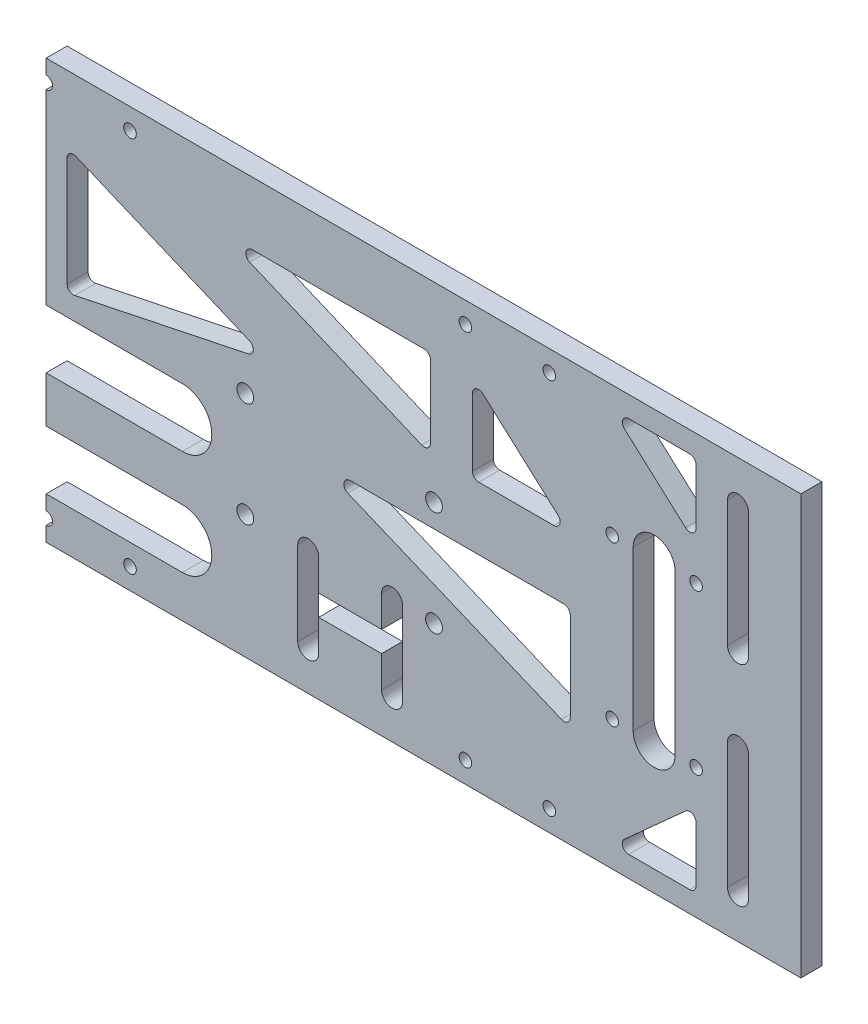
from build123d import *

# Parameters (mm, degrees)
SKETCH_1_W           = 320
SKETCH_1_H           = 121
EXTRUDE_1_DEPTH      = 5
SKETCH_2_W           = 5
SKETCH_2_H           = 30
CUT_EXTRUDE_1_DEPTH  = 343.14909031
SKETCH_3_R           = 1.5
CUT_EXTRUDE_2_DEPTH  = 343.14909031
SKETCH_4_R           = 1.5
CUT_EXTRUDE_3_DEPTH  = 343.14909031
SKETCH_6_R           = 2
CUT_EXTRUDE_5_DEPTH  = 343.14909031
SKETCH_5_W           = 250
SKETCH_5_H           = 30
CUT_EXTRUDE_4_DEPTH  = 343.14909031
SKETCH_7_W           = 260
SKETCH_7_H           = 30
EXTRUDE_2_DEPTH      = 5
SKETCH_8_W           = 320
SKETCH_8_H           = 21
CUT_EXTRUDE_6_DEPTH  = 5
SKETCH_9_W           = 15
SKETCH_9_H           = 100
EXTRUDE_3_DEPTH      = 5
CUT_EXTRUDE_7_DEPTH  = 5
CUT_EXTRUDE_8_DEPTH  = 5
SKETCH_15_R          = 1.5
CUT_EXTRUDE_9_DEPTH  = 357.217630108
CUT_EXTRUDE_10_DEPTH = 357.217630108
CUT_EXTRUDE_11_DEPTH = 357.217630108
SKETCH_18_W          = 5
SKETCH_18_H          = 100
EXTRUDE_4_DEPTH      = 5
SKETCH_19_W          = 180
SKETCH_19_H          = 100
CUT_EXTRUDE_12_DEPTH = 10
SKETCH_20_R          = 2
CUT_EXTRUDE_13_DEPTH = 10


with BuildPart() as part:
    # 草图1 → 凸台-拉伸1 (new body)
    with BuildSketch(Plane.XY):
        with Locations((160, 60.5)):
            Rectangle(SKETCH_1_W, SKETCH_1_H)
    extrude(amount=EXTRUDE_1_DEPTH)

    # 草图2 → 切除-拉伸1 (cut, through all)
    with BuildSketch(Plane.XY.offset(5)):
        with Locations((32.5, 15)):
            Rectangle(SKETCH_2_W, SKETCH_2_H)
        with Locations((287.5, 15)):
            Rectangle(SKETCH_2_W, SKETCH_2_H)
    extrude(amount=-CUT_EXTRUDE_1_DEPTH, mode=Mode.SUBTRACT)

    # 草图3 → 切除-拉伸2 (cut, through all)
    with BuildSketch(Plane.XY.offset(5)):
        with Locations((40, 116)):
            Circle(SKETCH_3_R)
        with Locations((60, 116)):
            Circle(SKETCH_3_R)
        with Locations((140, 116)):
            Circle(SKETCH_3_R)
        with Locations((160, 116)):
            Circle(SKETCH_3_R)
        with Locations((260, 116)):
            Circle(SKETCH_3_R)
        with Locations((280, 116)):
            Circle(SKETCH_3_R)
        with Locations((180, 116)):
            Circle(SKETCH_3_R)
    extrude(amount=-CUT_EXTRUDE_2_DEPTH, mode=Mode.SUBTRACT)

    # 草图4 → 切除-拉伸3 (cut, through all)
    with BuildSketch(Plane.XY.offset(5)):
        with Locations((5, 90)):
            Circle(SKETCH_4_R)
        with Locations((25, 90)):
            Circle(SKETCH_4_R)
        with Locations((5, 10)):
            Circle(SKETCH_4_R)
        with Locations((25, 10)):
            Circle(SKETCH_4_R)
        with Locations((295, 10)):
            Circle(SKETCH_4_R)
        with Locations((315, 10)):
            Circle(SKETCH_4_R)
        with Locations((295, 90)):
            Circle(SKETCH_4_R)
        with Locations((315, 90)):
            Circle(SKETCH_4_R)
    extrude(amount=-CUT_EXTRUDE_3_DEPTH, mode=Mode.SUBTRACT)

    # 草图6 → 切除-拉伸5 (cut, through all)
    with BuildSketch(Plane.XY.offset(5)):
        with Locations((112.5, 75.5)):
            Circle(SKETCH_6_R)
        with Locations((207.5, 75.5)):
            Circle(SKETCH_6_R)
        with Locations((207.5, 50.5)):
            Circle(SKETCH_6_R)
        with Locations((112.5, 50.5)):
            Circle(SKETCH_6_R)
        with BuildLine():
            Line((127.5, 70), (192.5, 70))
            ThreePointArc((192.5, 70), (199.5, 63), (192.5, 56))
            Line((192.5, 56), (127.5, 56))
            ThreePointArc((127.5, 56), (120.5, 63), (127.5, 70))
        make_face()
    extrude(amount=-CUT_EXTRUDE_5_DEPTH, mode=Mode.SUBTRACT)

    # 草图5 → 切除-拉伸4 (cut, through all)
    with BuildSketch(Plane.XY.offset(5)):
        with BuildLine():
            Line((5, 101.368043607), (5, 114.5))
            ThreePointArc((5, 114.5), (5.439339828, 115.560660172), (6.5, 116))
            Line((6.5, 116), (21.091062659, 116))
            ThreePointArc((21.091062659, 116), (22.491493276, 115.037395651), (22.094509756, 113.385058781))
            Line((22.094509756, 113.385058781), (7.503447097, 100.253102388))
            ThreePointArc((7.503447097, 100.253102388), (5.889742123, 99.997793512), (5, 101.368043607))
        make_face()
        with BuildLine():
            Line((38.908937341, 85), (56.833333333, 85))
            ThreePointArc((56.833333333, 85), (57.893993505, 85.439339828), (58.333333333, 86.5))
            Line((58.333333333, 86.5), (58.333333333, 102.631956393))
            ThreePointArc((58.333333333, 102.631956393), (57.443591211, 104.002206488), (55.829886236, 103.746897612))
            Line((55.829886236, 103.746897612), (37.905490244, 87.614941219))
            ThreePointArc((37.905490244, 87.614941219), (37.508506724, 85.962604349), (38.908937341, 85))
        make_face()
        with BuildLine():
            Line((35, 68.5), (35, 47.25))
            ThreePointArc((35, 47.25), (35.667949706, 46.001924558), (37.076923077, 45.865384615))
            Line((37.076923077, 45.865384615), (88.076923077, 67.115384615))
            ThreePointArc((88.076923077, 67.115384615), (88.970871014, 68.794174203), (87.5, 70))
            Line((87.5, 70), (36.5, 70))
            ThreePointArc((36.5, 70), (35.439339828, 69.560660172), (35, 68.5))
        make_face()
        with Locations((160, 15)):
            Rectangle(SKETCH_5_W, SKETCH_5_H)
        with BuildLine():
            Line((68.333333333, 87.256929624), (68.333333333, 104.5))
            ThreePointArc((68.333333333, 104.5), (68.772673162, 105.560660172), (69.833333333, 106))
            Line((69.833333333, 106), (110.888262801, 106))
            ThreePointArc((110.888262801, 106), (112.358715068, 104.796260242), (111.469111528, 103.117026842))
            Line((111.469111528, 103.117026842), (70.41418206, 85.873956465))
            ThreePointArc((70.41418206, 85.873956465), (69.00305419, 86.007675228), (68.333333333, 87.256929624))
        make_face()
        with BuildLine():
            Line((111.788920254, 84.01540935), (153.193641955, 75.376872258))
            ThreePointArc((153.193641955, 75.376872258), (154.446166722, 75.68130869), (155, 76.845253935))
            Line((155, 76.845253935), (155, 102.873774141))
            ThreePointArc((155, 102.873774141), (154.330279143, 104.123028536), (152.919151273, 104.256747299))
            Line((152.919151273, 104.256747299), (111.514429572, 86.866764185))
            ThreePointArc((111.514429572, 86.866764185), (110.602180826, 85.340055375), (111.788920254, 84.01540935))
        make_face()
        with BuildLine():
            Line((167.080848727, 104.256747299), (208.485570428, 86.866764185))
            ThreePointArc((208.485570428, 86.866764185), (209.397819174, 85.340055375), (208.211079746, 84.01540935))
            Line((208.211079746, 84.01540935), (166.806358045, 75.376872258))
            ThreePointArc((166.806358045, 75.376872258), (165.553833278, 75.68130869), (165, 76.845253935))
            Line((165, 76.845253935), (165, 102.873774141))
            ThreePointArc((165, 102.873774141), (165.669720857, 104.123028536), (167.080848727, 104.256747299))
        make_face()
        with BuildLine():
            Line((208.530888472, 103.117026842), (249.58581794, 85.873956465))
            ThreePointArc((249.58581794, 85.873956465), (250.99694581, 86.007675228), (251.666666667, 87.256929624))
            Line((251.666666667, 87.256929624), (251.666666667, 104.5))
            ThreePointArc((251.666666667, 104.5), (251.227326838, 105.560660172), (250.166666667, 106))
            Line((250.166666667, 106), (209.111737199, 106))
            ThreePointArc((209.111737199, 106), (207.641284932, 104.796260242), (208.530888472, 103.117026842))
        make_face()
        with BuildLine():
            Line((232.5, 70), (283.5, 70))
            ThreePointArc((283.5, 70), (284.560660172, 69.560660172), (285, 68.5))
            Line((285, 68.5), (285, 47.25))
            ThreePointArc((285, 47.25), (284.332050294, 46.001924558), (282.923076923, 45.865384615))
            Line((282.923076923, 45.865384615), (231.923076923, 67.115384615))
            ThreePointArc((231.923076923, 67.115384615), (231.029128986, 68.794174203), (232.5, 70))
        make_face()
        with BuildLine():
            Line((264.170113764, 103.746897612), (282.094509756, 87.614941219))
            ThreePointArc((282.094509756, 87.614941219), (282.491493276, 85.962604349), (281.091062659, 85))
            Line((281.091062659, 85), (263.166666667, 85))
            ThreePointArc((263.166666667, 85), (262.106006495, 85.439339828), (261.666666667, 86.5))
            Line((261.666666667, 86.5), (261.666666667, 102.631956393))
            ThreePointArc((261.666666667, 102.631956393), (262.556408789, 104.002206488), (264.170113764, 103.746897612))
        make_face()
        with BuildLine():
            Line((297.905490244, 113.385058781), (312.496552903, 100.253102388))
            ThreePointArc((312.496552903, 100.253102388), (314.110257877, 99.997793512), (315, 101.368043607))
            Line((315, 101.368043607), (315, 114.5))
            ThreePointArc((315, 114.5), (314.560660172, 115.560660172), (313.5, 116))
            Line((313.5, 116), (298.908937341, 116))
            ThreePointArc((298.908937341, 116), (297.508506724, 115.037395651), (297.905490244, 113.385058781))
        make_face()
    extrude(amount=-CUT_EXTRUDE_4_DEPTH, mode=Mode.SUBTRACT)

    # 草图7 → 凸台-拉伸2 (add)
    with BuildSketch(Plane(origin=(0, 0, 0), x_dir=(-1, 0, 0), z_dir=(0, 0, -1))):
        with Locations((-160, 15)):
            Rectangle(SKETCH_7_W, SKETCH_7_H)
    extrude(amount=-EXTRUDE_2_DEPTH)

    # 草图8 → 切除-拉伸6 (cut)
    with BuildSketch(Plane(origin=(0, 0, 0), x_dir=(-1, 0, 0), z_dir=(0, 0, -1))):
        with Locations((-160, 10.5)):
            Rectangle(SKETCH_8_W, SKETCH_8_H)
    extrude(amount=-CUT_EXTRUDE_6_DEPTH, mode=Mode.SUBTRACT)

    # 草图9 → 凸台-拉伸3 (add)
    with BuildSketch(Plane(origin=(0, 0, 0), x_dir=(-1, 0, 0), z_dir=(0, 0, -1))):
        with Locations((-327.5, 71)):
            Rectangle(SKETCH_9_W, SKETCH_9_H)
        with Locations((7.5, 71)):
            Rectangle(SKETCH_9_W, SKETCH_9_H)
    extrude(amount=-EXTRUDE_3_DEPTH)

    # 草图10 → 切除-拉伸7 (cut)
    with BuildSketch(Plane(origin=(0, 0, 0), x_dir=(-1, 0, 0), z_dir=(0, 0, -1))):
        with BuildLine():
            ThreePointArc((-327.5, 81), (-325, 78.5), (-322.5, 81))
            Line((-322.5, 81), (-322.5, 111))
            ThreePointArc((-322.5, 111), (-325, 113.5), (-327.5, 111))
            Line((-327.5, 111), (-327.5, 81))
        make_face()
        with BuildLine():
            ThreePointArc((-322.5, 61), (-325, 63.5), (-327.5, 61))
            Line((-327.5, 61), (-327.5, 31))
            ThreePointArc((-327.5, 31), (-325, 28.5), (-322.5, 31))
            Line((-322.5, 31), (-322.5, 61))
        make_face()
        with BuildLine():
            ThreePointArc((2.5, 81), (5, 78.5), (7.5, 81))
            Line((7.5, 81), (7.5, 111))
            ThreePointArc((7.5, 111), (5, 113.5), (2.5, 111))
            Line((2.5, 111), (2.5, 81))
        make_face()
        with BuildLine():
            ThreePointArc((7.5, 61), (5, 63.5), (2.5, 61))
            Line((2.5, 61), (2.5, 31))
            ThreePointArc((2.5, 31), (5, 28.5), (7.5, 31))
            Line((7.5, 31), (7.5, 61))
        make_face()
    extrude(amount=-CUT_EXTRUDE_7_DEPTH, mode=Mode.SUBTRACT)

    # 草图13 → 切除-拉伸8 (cut)
    with BuildSketch(Plane(origin=(0, 0, 0), x_dir=(-1, 0, 0), z_dir=(0, 0, -1))):
        with BuildLine():
            ThreePointArc((-192.5, 45), (-199.5, 38), (-192.5, 31))
            Line((-192.5, 31), (-127.5, 31))
            ThreePointArc((-127.5, 31), (-120.5, 38), (-127.5, 45))
            Line((-127.5, 45), (-192.5, 45))
        make_face()
    extrude(amount=-CUT_EXTRUDE_8_DEPTH, mode=Mode.SUBTRACT)

    # 草图15 → 切除-拉伸9 (cut, through all)
    with BuildSketch(Plane(origin=(0, 0, 0), x_dir=(-1, 0, 0), z_dir=(0, 0, -1))):
        with BuildLine():
            ThreePointArc((-22.094509756, 28.614941219), (-22.491493276, 26.962604349), (-21.091062659, 26))
            Line((-21.091062659, 26), (-6.5, 26))
            ThreePointArc((-6.5, 26), (-5.439339828, 26.439339828), (-5, 27.5))
            Line((-5, 27.5), (-5, 40.631956393))
            ThreePointArc((-5, 40.631956393), (-5.889742123, 42.002206488), (-7.503447097, 41.746897612))
            Line((-7.503447097, 41.746897612), (-22.094509756, 28.614941219))
        make_face()
        with BuildLine():
            Line((-315, 40.631956393), (-315, 27.5))
            ThreePointArc((-315, 27.5), (-314.560660172, 26.439339828), (-313.5, 26))
            Line((-313.5, 26), (-298.908937341, 26))
            ThreePointArc((-298.908937341, 26), (-297.508506724, 26.962604349), (-297.905490244, 28.614941219))
            Line((-297.905490244, 28.614941219), (-312.496552903, 41.746897612))
            ThreePointArc((-312.496552903, 41.746897612), (-314.110257877, 42.002206488), (-315, 40.631956393))
        make_face()
        with Locations((-25, 52)):
            Circle(SKETCH_15_R)
        with Locations((-5, 52)):
            Circle(SKETCH_15_R)
        with Locations((-40, 26)):
            Circle(SKETCH_15_R)
        with Locations((-60, 26)):
            Circle(SKETCH_15_R)
        with Locations((-140, 26)):
            Circle(SKETCH_15_R)
        with Locations((-160, 26)):
            Circle(SKETCH_15_R)
        with Locations((-180, 26)):
            Circle(SKETCH_15_R)
        with Locations((-260, 26)):
            Circle(SKETCH_15_R)
        with Locations((-280, 26)):
            Circle(SKETCH_15_R)
        with Locations((-295, 52)):
            Circle(SKETCH_15_R)
        with Locations((-315, 52)):
            Circle(SKETCH_15_R)
    extrude(amount=-CUT_EXTRUDE_9_DEPTH, mode=Mode.SUBTRACT)

    # 草图16 → 切除-拉伸10 (cut, through all)
    with BuildSketch(Plane(origin=(0, 0, 0), x_dir=(-1, 0, 0), z_dir=(0, 0, -1))):
        with BuildLine():
            Line((-310, 90), (-310, 52))
            ThreePointArc((-310, 52), (-305, 47), (-300, 52))
            Line((-300, 52), (-300, 90))
            ThreePointArc((-300, 90), (-305, 95), (-310, 90))
        make_face()
        with BuildLine():
            Line((-20, 90), (-20, 52))
            ThreePointArc((-20, 52), (-15, 47), (-10, 52))
            Line((-10, 52), (-10, 90))
            ThreePointArc((-10, 90), (-15, 95), (-20, 90))
        make_face()
    extrude(amount=-CUT_EXTRUDE_10_DEPTH, mode=Mode.SUBTRACT)

    # 草图17 → 切除-拉伸11 (cut, through all)
    with BuildSketch(Plane(origin=(0, 0, 0), x_dir=(-1, 0, 0), z_dir=(0, 0, -1))):
        with BuildLine():
            ThreePointArc((-220, 50.5), (-222.5, 53), (-225, 50.5))
            Line((-225, 50.5), (-225, 43))
            Line((-225, 43), (-240, 43))
            Line((-240, 43), (-240, 50.5))
            ThreePointArc((-240, 50.5), (-242.5, 53), (-245, 50.5))
            Line((-245, 50.5), (-245, 30.5))
            ThreePointArc((-245, 30.5), (-242.5, 28), (-240, 30.5))
            Line((-240, 30.5), (-240, 38))
            Line((-240, 38), (-225, 38))
            Line((-225, 38), (-225, 30.5))
            ThreePointArc((-225, 30.5), (-222.5, 28), (-220, 30.5))
            Line((-220, 30.5), (-220, 50.5))
        make_face()
        with BuildLine():
            ThreePointArc((-95, 50.5), (-97.5, 53), (-100, 50.5))
            Line((-100, 50.5), (-100, 30.5))
            ThreePointArc((-100, 30.5), (-97.5, 28), (-95, 30.5))
            Line((-95, 30.5), (-95, 38))
            Line((-95, 38), (-80, 38))
            Line((-80, 38), (-80, 30.5))
            ThreePointArc((-80, 30.5), (-77.5, 28), (-75, 30.5))
            Line((-75, 30.5), (-75, 50.5))
            ThreePointArc((-75, 50.5), (-77.5, 53), (-80, 50.5))
            Line((-80, 50.5), (-80, 43))
            Line((-80, 43), (-95, 43))
            Line((-95, 43), (-95, 50.5))
        make_face()
    extrude(amount=-CUT_EXTRUDE_11_DEPTH, mode=Mode.SUBTRACT)

    # 草图18 → 凸台-拉伸4 (add)
    with BuildSketch(Plane(origin=(0, 0, 0), x_dir=(-1, 0, 0), z_dir=(0, 0, -1))):
        with Locations((-337.5, 71)):
            Rectangle(SKETCH_18_W, SKETCH_18_H)
        with Locations((17.5, 71)):
            Rectangle(SKETCH_18_W, SKETCH_18_H)
    extrude(amount=-EXTRUDE_4_DEPTH)

    # 草图19 → 切除-拉伸12 (cut)
    with BuildSketch(Plane.XY.offset(5)):
        with Locations((70, 71)):
            Rectangle(SKETCH_19_W, SKETCH_19_H)
    extrude(amount=-CUT_EXTRUDE_12_DEPTH, mode=Mode.SUBTRACT)

    # 草图20 → 切除-拉伸13 (cut)
    with BuildSketch(Plane.XY.offset(5)):
        with Locations((252.5, 75.5)):
            Circle(SKETCH_20_R)
        with Locations((252.5, 50.5)):
            Circle(SKETCH_20_R)
    extrude(amount=-CUT_EXTRUDE_13_DEPTH, mode=Mode.SUBTRACT)


solid = part.part
